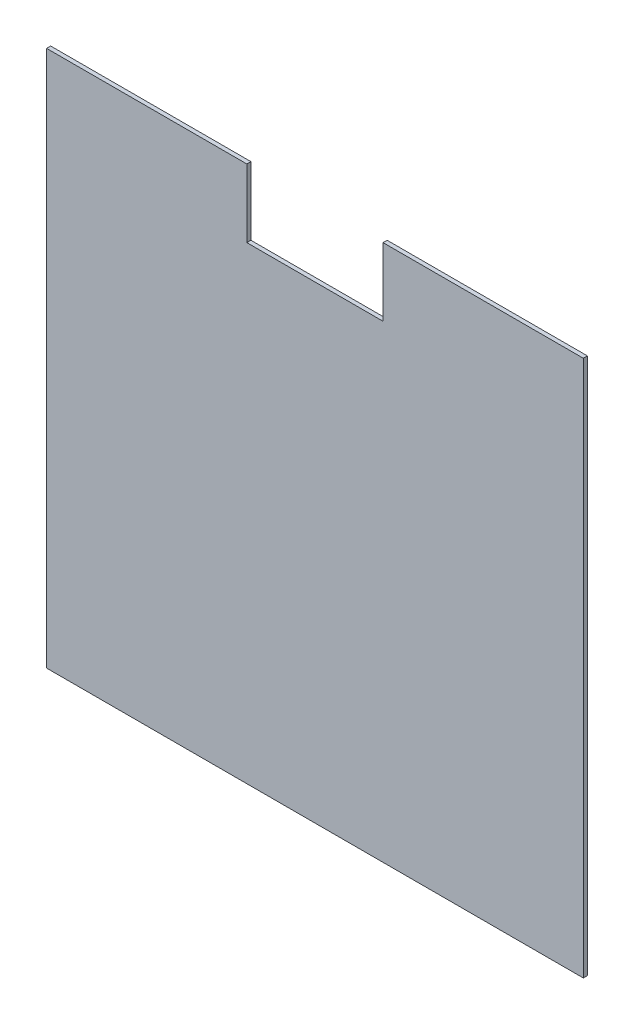
from build123d import *

# Parameters (mm, degrees)
ESTRUSIONE_ESTRUSIONE1_DEPTH = 3


with BuildPart() as part:
    # Schizzo1 → Estrusione-Estrusione1 (new body)
    with BuildSketch(Plane.XY):
        Polygon((0, 0), (0, 394), (147, 394), (147, 344), (247, 344), (247, 394), (394, 394), (394, 0), align=None)
    extrude(amount=ESTRUSIONE_ESTRUSIONE1_DEPTH)


solid = part.part
